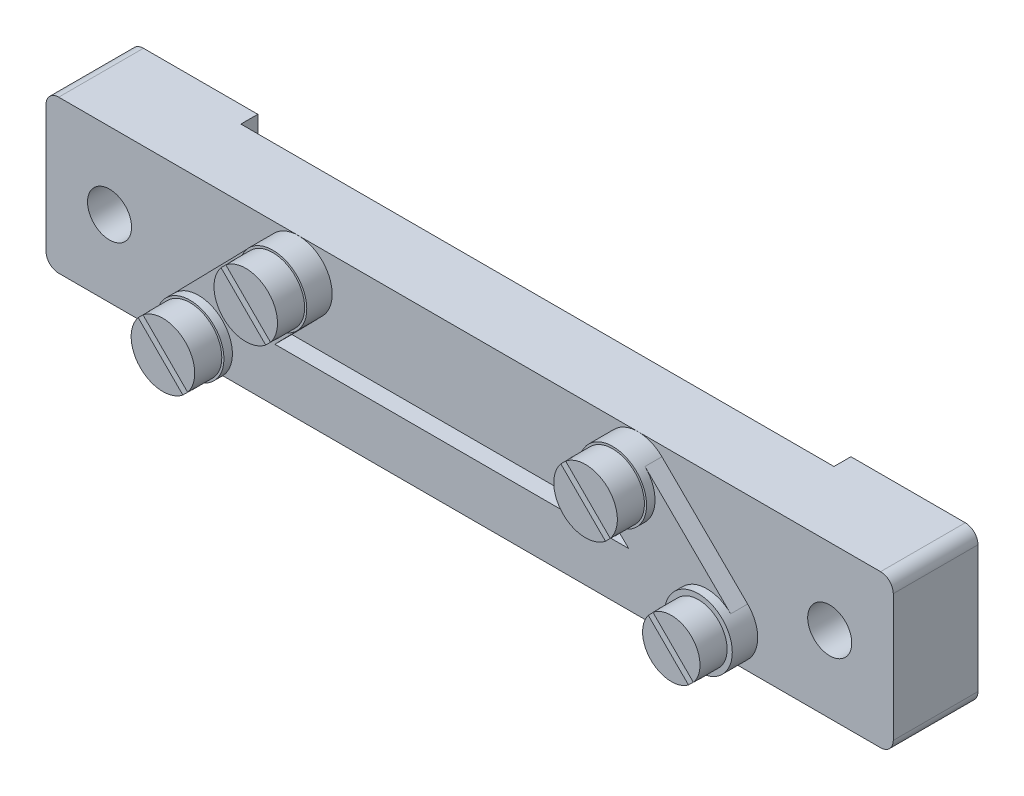
from build123d import *
from build123d.topology import SkipClean

# Parameters (mm, degrees)
SKETCH_1_W          = 100
SKETCH_1_H          = 18
SKETCH_1_R          = 2.6
SKETCH_1_R_2        = 2
SKETCH_1_R_3        = 1.5
EXTRUDE_1_DEPTH     = 10
SKETCH_2_W          = 70
SKETCH_2_H          = 18
CUT_EXTRUDE_1_DEPTH = 2
FILLET_1_R          = 1.5
EXTRUDE_3_DEPTH     = 2
SKETCH_4_R          = 4
EXTRUDE_4_DEPTH     = 1
SKETCH_5_R          = 3.38932831
EXTRUDE_5_DEPTH     = 3.2
SKETCH_6_R          = 3.75
EXTRUDE_6_DEPTH     = 3.2
SKETCH_7_R          = 3.75
EXTRUDE_7_DEPTH     = 3.2
SKETCH_8_R          = 3.75
EXTRUDE_8_DEPTH     = 3.2
CUT_EXTRUDE_2_DEPTH = 1
CUT_EXTRUDE_3_DEPTH = 1
CUT_EXTRUDE_4_DEPTH = 1


with BuildPart() as part:
    # Эскиз1 → Вытянуть1 (new body)
    with BuildSketch(Plane.XY):
        with Locations((50, 9)):
            Rectangle(SKETCH_1_W, SKETCH_1_H)
        with Locations((7.5, 9)):
            Circle(SKETCH_1_R, mode=Mode.SUBTRACT)
        with Locations((92.5, 9)):
            Circle(SKETCH_1_R, mode=Mode.SUBTRACT)
        with Locations((20, 4)):
            Circle(SKETCH_1_R_2, mode=Mode.SUBTRACT)
        with Locations((80, 4)):
            Circle(SKETCH_1_R_2, mode=Mode.SUBTRACT)
        with Locations((30, 14)):
            Circle(SKETCH_1_R_3, mode=Mode.SUBTRACT)
        with Locations((70, 14)):
            Circle(SKETCH_1_R_3, mode=Mode.SUBTRACT)
    extrude(amount=EXTRUDE_1_DEPTH)

    # Эскиз2 → Вырез-Вытянуть1 (cut)
    with BuildSketch(Plane(origin=(0, 0, 0), x_dir=(-1, 0, 0), z_dir=(0, 0, -1))):
        with Locations((-50, 9)):
            Rectangle(SKETCH_2_W, SKETCH_2_H)
    extrude(amount=-CUT_EXTRUDE_1_DEPTH, mode=Mode.SUBTRACT)

    # Скругление1
    fillet_1_edges = [part.edges().sort_by_distance(p)[0] for p in [
        (100, 0, 5),
        (0, 0, 5),
        (100, 18, 5),
        (0, 18, 5),
    ]]
    fillet(fillet_1_edges, radius=FILLET_1_R)

    # Эскиз3 → Вытянуть3 (add)
    with BuildSketch(Plane.XY.offset(10)):
        with BuildLine():
            Line((72.692526424, 16.844371856), (82.811526632, 6.845227231))
            ThreePointArc((82.811526632, 6.845227231), (82.845227231, 1.188473368), (77.188473368, 1.154772769))
            Line((77.188473368, 1.154772769), (77.139063674, 1.203597224))
            Line((77.139063674, 1.203597224), (22.860092921, 1.203597224))
            ThreePointArc((22.860092921, 1.203597224), (17.203597224, 1.139907079), (17.139907079, 6.796402776))
            Line((17.139907079, 6.796402776), (26.916385172, 16.795547401))
            ThreePointArc((26.916385172, 16.795547401), (32.572880868, 16.859237546), (32.636571013, 11.20274185))
            Line((32.636571013, 11.20274185), (29.016893244, 7.500623237))
            Line((29.016893244, 7.500623237), (70.766557833, 7.500623237))
            Line((70.766557833, 7.500623237), (67.06947316, 11.153917394))
            ThreePointArc((67.06947316, 11.153917394), (67.035772561, 16.810671257), (72.692526424, 16.844371856))
        make_face()
    extrude(amount=EXTRUDE_3_DEPTH)

    # Эскиз4 → Вытянуть4 (add)
    with SkipClean():  # the faces are left unmerged after this step: merging them gives an invalid solid
        with BuildSketch(Plane.XY.offset(12)):
            with Locations(Location((20, 4, 0), (0, 0, 135.645102996))):
                Circle(SKETCH_4_R)
            with Locations(Location((29.776478092, 13.999144625, 0), (0, 0, 135.645102996))):
                Circle(SKETCH_4_R)
            with Locations(Location((69.880999792, 13.999144625, 0), (0, 0, 225.341340509))):
                Circle(SKETCH_4_R)
            with Locations(Location((80, 4, 0), (0, 0, 225.341340509))):
                Circle(SKETCH_4_R)
        extrude(amount=EXTRUDE_4_DEPTH)
    add(part.part.scale(1), mode=Mode.REPLACE)  # the faces are merged on a copy

    # Эскиз5 → Вытянуть5 (add)
    with BuildSketch(Plane.XY.offset(13)):
        with Locations(Location((80, 4, 0), (0, 0, 143.222791585))):
            Circle(SKETCH_5_R)
    extrude(amount=EXTRUDE_5_DEPTH)

    # Эскиз6 → Вытянуть6 (add)
    with BuildSketch(Plane.XY.offset(13)):
        with Locations(Location((69.880999792, 13.999144625, 0), (0, 0, 141.123198866))):
            Circle(SKETCH_6_R)
    extrude(amount=EXTRUDE_6_DEPTH)

    # Эскиз7 → Вытянуть7 (add)
    with BuildSketch(Plane.XY.offset(13)):
        with Locations(Location((29.776478092, 13.999144625, 0), (0, 0, 141.123198866))):
            Circle(SKETCH_7_R)
    extrude(amount=EXTRUDE_7_DEPTH)

    # Эскиз8 → Вытянуть8 (add)
    with BuildSketch(Plane.XY.offset(13)):
        with Locations(Location((20, 4, 0), (0, 0, 141.123198866))):
            Circle(SKETCH_8_R)
    extrude(amount=EXTRUDE_8_DEPTH)

    # Эскиз9 → Вырез-Вытянуть2 (cut)
    with BuildSketch(Plane.XY.offset(16.2)):
        Polygon((16.157845588, 7.276468987), (24.091280084, -0.656965509), (24.596689062, -0.031003637), (16.723531013, 7.842154412), align=None)
    extrude(amount=-CUT_EXTRUDE_2_DEPTH, mode=Mode.SUBTRACT)

    # Эскиз10 → Вырез-Вытянуть3 (cut)
    with BuildSketch(Plane.XY.offset(16.2)):
        Polygon((23.332366462, 19.877570831), (34.653872269, 8.556065024), (35.333565103, 9.007743039), (23.898051887, 20.443256256), align=None)
    extrude(amount=-CUT_EXTRUDE_3_DEPTH, mode=Mode.SUBTRACT)

    # Эскиз11 → Вырез-Вытянуть4 (cut)
    with BuildSketch(Plane.XY.offset(16.2)):
        Polygon((62.841835451, 20.472623541), (84.739405762, -1.42494677), (85.695784292, -1.249954449), (63.522860335, 20.922969507), align=None)
    extrude(amount=-CUT_EXTRUDE_4_DEPTH, mode=Mode.SUBTRACT)


solid = part.part
